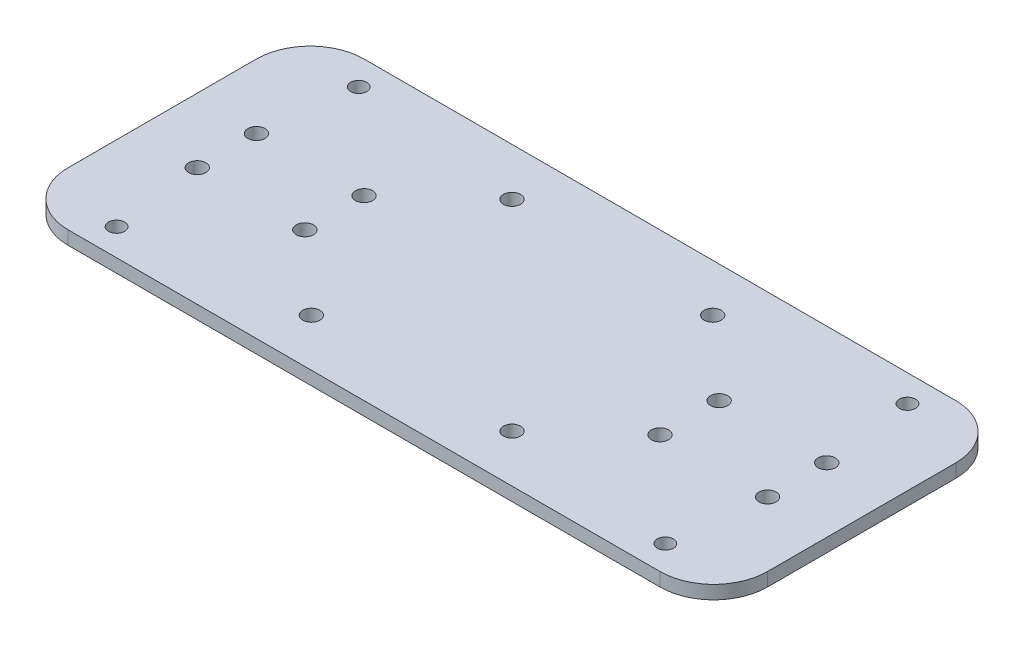
from build123d import *

# Parameters (mm, degrees)
BOSS_EXTRUDE1_DEPTH = 2.5
SKETCH2_R           = 1.5
CUT_EXTRUDE1_DEPTH  = 142.178079035
SKETCH3_R           = 1.6
CUT_EXTRUDE2_DEPTH  = 10
SKETCH4_R           = 1.6
CUT_EXTRUDE3_DEPTH  = 10
SKETCH5_R           = 1.6
CUT_EXTRUDE4_DEPTH  = 10
SKETCH8_R           = 1.6
CUT_EXTRUDE5_DEPTH  = 10
SKETCH9_R           = 1.6
CUT_EXTRUDE6_DEPTH  = 10


with BuildPart() as part:
    # Sketch1 → Boss-Extrude1 (new body)
    with BuildSketch(Plane(origin=(0, 0, 0), x_dir=(1, 0, 0), z_dir=(0, 1, 0))):
        with BuildLine():
            Line((10, 0), (120, 0))
            ThreePointArc((120, 0), (127.071067812, 2.928932188), (130, 10))
            Line((130, 10), (130, 45))
            ThreePointArc((130, 45), (127.071067812, 52.071067812), (120, 55))
            Line((120, 55), (10, 55))
            ThreePointArc((10, 55), (2.928932188, 52.071067812), (0, 45))
            Line((0, 45), (0, 10))
            ThreePointArc((0, 10), (2.928932188, 2.928932188), (10, 0))
        make_face()
    extrude(amount=BOSS_EXTRUDE1_DEPTH)

    # Sketch2 → Cut-Extrude1 (cut, through all)
    with BuildSketch(Plane(origin=(0, 2.5, 0), x_dir=(1, 0, 0), z_dir=(0, 1, 0))):
        with Locations((14, 5)):
            Circle(SKETCH2_R)
        with Locations((14, 50)):
            Circle(SKETCH2_R)
        with Locations((116, 5)):
            Circle(SKETCH2_R)
        with Locations((116, 50)):
            Circle(SKETCH2_R)
    extrude(amount=-CUT_EXTRUDE1_DEPTH, mode=Mode.SUBTRACT)

    # Sketch3 → Cut-Extrude2 (cut)
    with BuildSketch(Plane(origin=(0, 2.5, 0), x_dir=(1, 0, 0), z_dir=(0, 1, 0))):
        with Locations((12, 33)):
            Circle(SKETCH3_R)
    extrude(amount=-CUT_EXTRUDE2_DEPTH, mode=Mode.SUBTRACT)

    # Sketch4 → Cut-Extrude3 (cut)
    with BuildSketch(Plane(origin=(0, 2.5, 0), x_dir=(1, 0, 0), z_dir=(0, 1, 0))):
        with Locations((12, 22)):
            Circle(SKETCH4_R)
    extrude(amount=-CUT_EXTRUDE3_DEPTH, mode=Mode.SUBTRACT)

    # Sketch5 → Cut-Extrude4 (cut)
    with BuildSketch(Plane(origin=(0, 2.5, 0), x_dir=(1, 0, 0), z_dir=(0, 1, 0))):
        with Locations((32, 33)):
            Circle(SKETCH5_R)
        with Locations((32, 22)):
            Circle(SKETCH5_R)
    extrude(amount=-CUT_EXTRUDE4_DEPTH, mode=Mode.SUBTRACT)

    # Sketch8 → Cut-Extrude5 (cut)
    with BuildSketch(Plane(origin=(0, 2.5, 0), x_dir=(1, 0, 0), z_dir=(0, 1, 0))):
        with Locations((98, 33)):
            Circle(SKETCH8_R)
        with Locations((98, 22)):
            Circle(SKETCH8_R)
        with Locations((118, 33)):
            Circle(SKETCH8_R)
        with Locations((118, 22)):
            Circle(SKETCH8_R)
    extrude(amount=-CUT_EXTRUDE5_DEPTH, mode=Mode.SUBTRACT)

    # Sketch9 → Cut-Extrude6 (cut)
    with BuildSketch(Plane(origin=(0, 2.5, 0), x_dir=(1, 0, 0), z_dir=(0, 1, 0))):
        with Locations((46.35, 46.15)):
            Circle(SKETCH9_R)
        with Locations((83.65, 46.15)):
            Circle(SKETCH9_R)
        with Locations((83.65, 8.85)):
            Circle(SKETCH9_R)
        with Locations((46.35, 8.85)):
            Circle(SKETCH9_R)
    extrude(amount=-CUT_EXTRUDE6_DEPTH, mode=Mode.SUBTRACT)


solid = part.part
